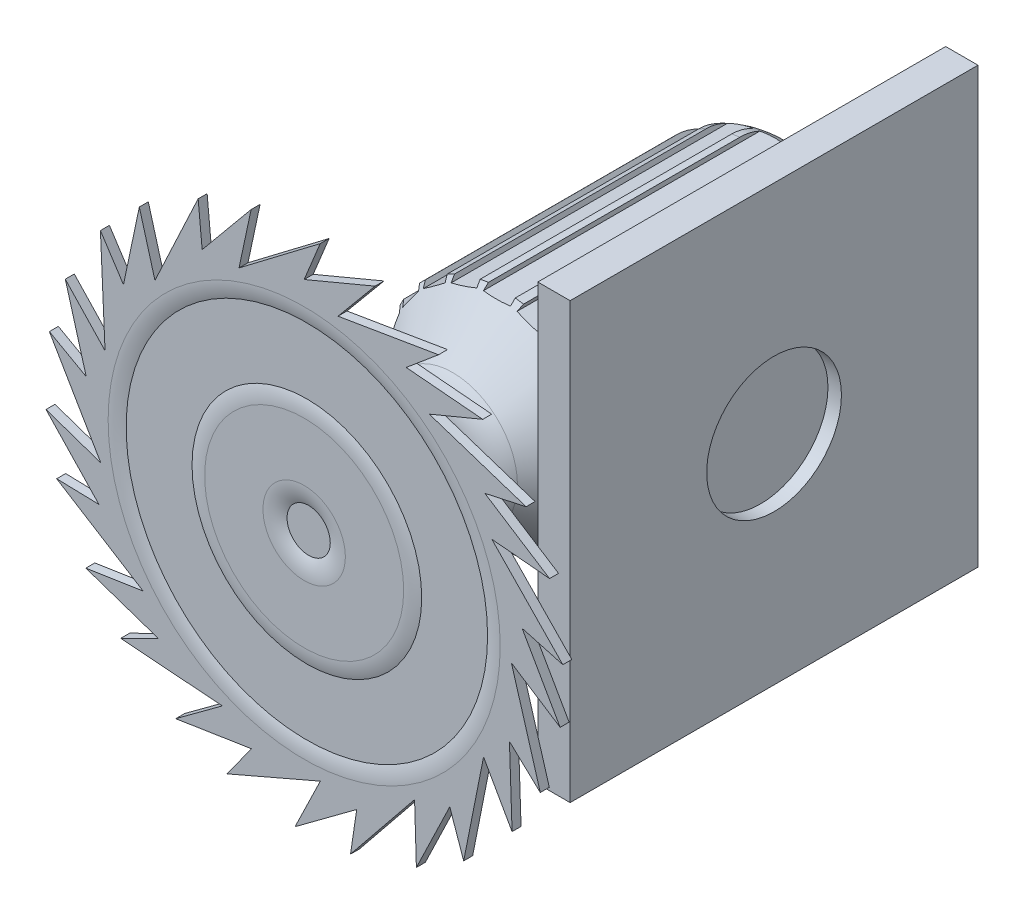
from build123d import *

# Parameters (mm, degrees)
SKETCH1_R           = 125
BOSS_EXTRUDE1_DEPTH = 400
CHAMFER1_SIZE       = 70
CHAMFER1_SIZE2      = 67.598214236
FILLET1_R           = 50
CUT_EXTRUDE1_DEPTH  = 438.321392113
SKETCH3_R           = 15
BOSS_EXTRUDE2_DEPTH = 150
FILLET2_R           = 50
SKETCH4_R           = 288.449924122
BOSS_EXTRUDE3_DEPTH = 10
SKETCH5_R           = 361.002491693
CUT_EXTRUDE2_DEPTH  = 685.767637643
SKETCH6_R           = 24.066556302
CUT_EXTRUDE4_DEPTH  = 5
FILLET3_R           = 50
SKETCH7_R           = 201.17505396
SKETCH7_R_2         = 127.842578793
CUT_EXTRUDE5_DEPTH  = 3
FILLET4_R           = 50
SKETCH8_W           = 454.050466569
SKETCH8_H           = 483.92077128
BOSS_EXTRUDE4_DEPTH = 36
SKETCH10_R          = 75
CUT_EXTRUDE6_DEPTH  = 15


with BuildPart() as part:
    # Sketch1 → Boss-Extrude1 (new body)
    with BuildSketch(Plane.XY):
        Circle(SKETCH1_R)
    extrude(amount=BOSS_EXTRUDE1_DEPTH)

    # Chamfer1
    chamfer1_edges = [part.edges().sort_by_distance(p)[0] for p in [
        (-125, 0, 400),
    ]]
    chamfer1_side = [part.faces().sort_by_distance(p)[0] for p in [
        (-125, 0, 200),
    ]]
    chamfer(chamfer1_edges, length=CHAMFER1_SIZE, length2=CHAMFER1_SIZE2, reference=chamfer1_side[0])

    # Fillet1
    fillet1_edges = [part.edges().sort_by_distance(p)[0] for p in [
        (-125, 0, 0),
    ]]
    fillet(fillet1_edges, radius=FILLET1_R)

    # Sketch2 → Cut-Extrude1 (cut, through all)
    with BuildSketch(Plane.XY.offset(400)):
        Polygon((-14.981137067, 148.845318575), (-9.522904666, 173.29188934), (15, 148.843418832), (15, 118.843418832), (-14.981137067, 118.843418832), align=None)
        Polygon((31.747824944, 146.1897361), (22.476728059, 117.656233848), (50.990483833, 108.391552983), (60.260993664, 136.923248472), (44.493318257, 167.753119956), align=None)
        Polygon((75.369088649, 129.224083691), (57.734414439, 104.952036935), (81.989663837, 87.32956672), (99.623221406, 111.600076552), (94.154225185, 145.793506385), align=None)
        Polygon((111.61270083, 99.609077614), (87.340654074, 81.974403404), (104.963124289, 57.719154006), (129.23363412, 75.352711575), (134.598660542, 109.562608607), align=None)
        Polygon((136.930884202, 60.243641002), (108.39738195, 50.972544118), (117.662062815, 22.458788344), (146.193758303, 31.729298176), (161.8676412, 62.60695933), align=None)
        Polygon((148.845318575, 14.981137067), (118.843418832, 14.981137067), (118.843418832, -15), (148.843418832, -15), (173.29188934, 9.522904666), align=None)
        Polygon((146.1897361, -31.747824944), (117.656233848, -22.476728059), (108.391552983, -50.990483833), (136.923248472, -60.260993664), (167.753119956, -44.493318257), align=None)
        Polygon((129.224083691, -75.369088649), (104.952036935, -57.734414439), (87.32956672, -81.989663837), (111.600076552, -99.623221406), (145.793506385, -94.154225185), align=None)
        Polygon((99.609077614, -111.61270083), (81.974403404, -87.340654074), (57.719154006, -104.963124289), (75.352711575, -129.23363412), (109.562608607, -134.598660542), align=None)
        Polygon((60.243641002, -136.930884202), (50.972544118, -108.39738195), (22.458788344, -117.662062815), (31.729298176, -146.193758303), (62.60695933, -161.8676412), align=None)
        Polygon((14.981137067, -148.845318575), (14.981137067, -118.843418832), (-15, -118.843418832), (-15, -148.843418832), (9.522904666, -173.29188934), align=None)
        Polygon((-31.747824944, -146.1897361), (-22.476728059, -117.656233848), (-50.990483833, -108.391552983), (-60.260993664, -136.923248472), (-44.493318257, -167.753119956), align=None)
        Polygon((-75.369088649, -129.224083691), (-57.734414439, -104.952036935), (-81.989663837, -87.32956672), (-99.623221406, -111.600076552), (-94.154225185, -145.793506385), align=None)
        Polygon((-111.61270083, -99.609077614), (-87.340654074, -81.974403404), (-104.963124289, -57.719154006), (-129.23363412, -75.352711575), (-134.598660542, -109.562608607), align=None)
        Polygon((-136.930884202, -60.243641002), (-108.39738195, -50.972544118), (-117.662062815, -22.458788344), (-146.193758303, -31.729298176), (-161.8676412, -62.60695933), align=None)
        Polygon((-148.845318575, -14.981137067), (-118.843418832, -14.981137067), (-118.843418832, 15), (-148.843418832, 15), (-173.29188934, -9.522904666), align=None)
        Polygon((-146.1897361, 31.747824944), (-117.656233848, 22.476728059), (-108.391552983, 50.990483833), (-136.923248472, 60.260993664), (-167.753119956, 44.493318257), align=None)
        Polygon((-129.224083691, 75.369088649), (-104.952036935, 57.734414439), (-87.32956672, 81.989663837), (-111.600076552, 99.623221406), (-145.793506385, 94.154225185), align=None)
        Polygon((-99.609077614, 111.61270083), (-81.974403404, 87.340654074), (-57.719154006, 104.963124289), (-75.352711575, 129.23363412), (-109.562608607, 134.598660542), align=None)
        Polygon((-60.243641002, 136.930884202), (-50.972544118, 108.39738195), (-22.458788344, 117.662062815), (-31.729298176, 146.193758303), (-62.60695933, 161.8676412), align=None)
    extrude(amount=-CUT_EXTRUDE1_DEPTH, mode=Mode.SUBTRACT)

    # Sketch3 → Boss-Extrude2 (add)
    with BuildSketch(Plane.XY.offset(400)):
        Circle(SKETCH3_R)
    extrude(amount=BOSS_EXTRUDE2_DEPTH)

    # Fillet2
    fillet2_edges = [part.edges().sort_by_distance(p)[0] for p in [
        (-57.401785764, 0, 400),
    ]]
    fillet(fillet2_edges, radius=FILLET2_R)

    # Sketch4 → Boss-Extrude3 (add)
    with BuildSketch(Plane.XY.offset(550)):
        Circle(SKETCH4_R)
    extrude(amount=-BOSS_EXTRUDE3_DEPTH)

    # Sketch5 → Cut-Extrude2 (cut, through all)
    with BuildSketch(Plane.XY.offset(550)):
        Circle(SKETCH5_R)
        Polygon((-72.536701971, 219.269890817), (17.818461746, 287.899046798), (0, 244.397341979), (78.908059012, 277.447070536), (37.671739353, 227.863332297), (149.570822577, 246.641293704), (113.577108004, 216.403099109), (198.805699019, 208.996776922), (139.250039185, 184.2560304), (247.05831048, 148.880992572), (201.135069316, 138.833514173), (273.159349249, 92.667840399), (208.927833184, 98.437892463), (287.947716827, 17.013850252), (242.615410189, 29.458844265), (284.935484493, -44.890181591), (230.742778454, -9.931180331), (262.871771395, -118.750960122), (228.51548442, -86.664491846), (231.436334084, -172.164403963), (199.697333933, -116.025139396), (177.575071085, -227.311356635), (162.06541508, -182.934037296), (124.917908647, -259.997836194), (122.903636821, -195.539137279), (51.598062001, -283.797460743), (58.488112246, -237.295599396), (-10.217704237, -288.268897466), (17.954197663, -230.257475314), (-86.199441264, -275.268986724), (-58.488112246, -237.295599396), (-143.012564217, -250.501028346), (-91.108331808, -212.226600658), (-204.24969135, -203.679705198), (-162.06541508, -182.934037296), (-243.044969223, -155.346392496), (-179.299040437, -145.577169398), (-275.508798625, -85.429857817), (-228.51548442, -86.664491846), (-287.39870079, -24.603770252), (-226.414499688, -45.577763025), (-283.652160375, 52.390940448), (-242.615410189, 29.458844265), (-265.912853535, 111.775279249), (-221.661125652, 64.862959585), (-226.814230562, 178.209605635), (-201.135069316, 138.833514173), (-183.509576133, 222.547959312), (-166.127859035, 160.444359838), (-118.015893936, 263.202597831), (-113.577108004, 216.403099109), (-59.066466369, 282.33758389), align=None, mode=Mode.SUBTRACT)
    extrude(amount=-CUT_EXTRUDE2_DEPTH, mode=Mode.SUBTRACT)

    # Sketch6 → Cut-Extrude4 (cut)
    with BuildSketch(Plane.XY.offset(550)):
        Circle(SKETCH6_R)
    extrude(amount=-CUT_EXTRUDE4_DEPTH, mode=Mode.SUBTRACT)

    # Fillet3
    # the kernel refuses this fillet: 50 mm, written as the material it takes off along each edge
    with BuildSketch(Plane(origin=(0, 0, 550), x_dir=(1, 0, 0), z_dir=(0, -1, 0))) as fillet3_piece_1:
        with BuildLine():
            CenterArc((45.86105102, -50), FILLET3_R, 90, 25.841932763)
            Line((24.066556302, -5), (23.630666408, -4.1))
            ThreePointArc((23.630666408, -4.1), (23.066556302, -2.5), (23.066556302, 0))
            Line((23.066556302, 0), (24.066556302, 1))
            Line((24.066556302, 1), (45.86105102, 1))
            Line((45.86105102, 1), (45.86105102, 0))
        make_face()
    revolve(axis=Axis((0, 0, 550), (0, 0, 1)), mode=Mode.SUBTRACT)

    # Sketch7 → Cut-Extrude5 (cut)
    with BuildSketch(Plane.XY.offset(550)):
        Circle(SKETCH7_R)
        Circle(SKETCH7_R_2, mode=Mode.SUBTRACT)
    extrude(amount=-CUT_EXTRUDE5_DEPTH, mode=Mode.SUBTRACT)

    # Fillet4
    # the kernel refuses this fillet: 50 mm, written as the material it takes off along each edge
    with BuildSketch(Plane(origin=(0, 0, 550), x_dir=(1, 0, 0), z_dir=(0, -1, 0))) as fillet4_piece_1:
        with BuildLine():
            CenterArc((218.23377607, -50), FILLET4_R, 90, 19.948443589)
            Line((201.17505396, -3), (200.833879518, -2.06))
            ThreePointArc((200.833879518, -2.06), (200.17505396, -1.5), (200.17505396, 0))
            Line((200.17505396, 0), (201.17505396, 1))
            Line((201.17505396, 1), (218.23377607, 1))
            Line((218.23377607, 1), (218.23377607, 0))
        make_face()
    revolve(axis=Axis((0, 0, 550), (0, 0, 1)), mode=Mode.SUBTRACT)
    with BuildSketch(Plane(origin=(0, 0, 550), x_dir=(1, 0, 0), z_dir=(0, -1, 0))) as fillet4_piece_2:
        with BuildLine():
            CenterArc((110.783856683, -50), FILLET4_R, 70.051556411, 19.948443589)
            Line((110.783856683, 0), (110.783856683, 1))
            Line((110.783856683, 1), (127.842578793, 1))
            Line((127.842578793, 1), (128.842578793, 0))
            ThreePointArc((128.842578793, 0), (128.842578793, -1.5), (128.183753235, -2.06))
            Line((128.183753235, -2.06), (127.842578793, -3))
        make_face()
    revolve(axis=Axis((0, 0, 550), (0, 0, 1)), mode=Mode.SUBTRACT)


with BuildPart() as body_2:
    # Sketch8 → Boss-Extrude4 (new body)
    with BuildSketch(Plane(origin=(130, 0, 0), x_dir=(0, 0, -1), z_dir=(1, 0, 0))):
        with Locations((-192.911780056, 0)):
            Rectangle(SKETCH8_W, SKETCH8_H)
    extrude(amount=BOSS_EXTRUDE4_DEPTH)

    # Sketch10 → Cut-Extrude6 (cut)
    with BuildSketch(Plane(origin=(166, 0, 0), x_dir=(0, 0, -1), z_dir=(1, 0, 0))):
        with Locations((-192.911780055, 0)):
            Circle(SKETCH10_R)
    extrude(amount=-CUT_EXTRUDE6_DEPTH, mode=Mode.SUBTRACT)


solid = Compound([part.part, body_2.part])
